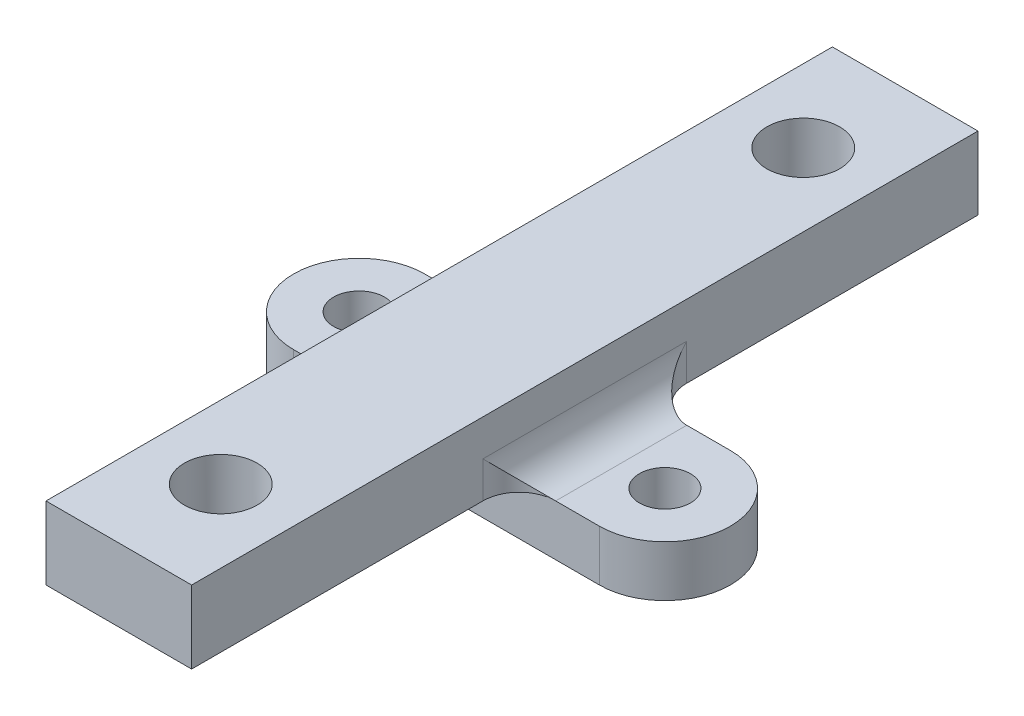
from build123d import *

# Parameters (mm, degrees)
BOSS_EXTRUDE1_DEPTH = 7
SKETCH2_R           = 3
BOSS_EXTRUDE2_DEPTH = 1
SKETCH3_R           = 3.5
CUT_EXTRUDE1_DEPTH  = 5
SKETCH4_R           = 1.5
CUT_EXTRUDE2_DEPTH  = 32.717503054
SKETCH17_W          = 20
SKETCH17_H          = 18
BOSS_EXTRUDE6_DEPTH = 10
SKETCH18_W          = 20
SKETCH18_H          = 10
BOSS_EXTRUDE7_DEPTH = 45
CUT_EXTRUDE6_REACH  = 66.343
SKETCH19_R          = 5
FILLET4_R           = 5
FILLET6_R           = 5
FILLET8_R           = 5


with BuildPart() as part:
    # Sketch1 → Boss-Extrude1 (new body)
    with BuildSketch(Plane(origin=(0, 0, 0), x_dir=(1, 0, 0), z_dir=(0, 1, 0))):
        with BuildLine():
            Line((-21, 9), (21, 9))
            ThreePointArc((21, 9), (30, 0), (21, -9))
            Line((21, -9), (-21, -9))
            ThreePointArc((-21, -9), (-30, 0), (-21, 9))
        make_face()
    extrude(amount=BOSS_EXTRUDE1_DEPTH)

    # Sketch2 → Boss-Extrude2 (add)
    with BuildSketch(Plane.XZ):
        with Locations(Location((-21, 0, 0), (0, 0, 270))):
            Circle(SKETCH2_R)
    boss_extrude2 = extrude(amount=BOSS_EXTRUDE2_DEPTH)

    # Sketch3 → Cut-Extrude1 (cut)
    with BuildSketch(Plane(origin=(0, 7, 0), x_dir=(1, 0, 0), z_dir=(0, 1, 0))):
        with Locations(Location((-21, 0, 0), (0, 0, 270))):
            Circle(SKETCH3_R)
    cut_extrude1 = extrude(amount=-CUT_EXTRUDE1_DEPTH, mode=Mode.SUBTRACT)

    # Sketch4 → Cut-Extrude2 (cut, through all)
    with BuildSketch(Plane(origin=(0, 2, 0), x_dir=(1, 0, 0), z_dir=(0, 1, 0))):
        with Locations(Location((-21, 0, 0), (0, 0, 270))):
            Circle(SKETCH4_R)
    cut_extrude2 = extrude(amount=-CUT_EXTRUDE2_DEPTH, mode=Mode.SUBTRACT)

    # Mirror1: Boss-Extrude2, Cut-Extrude1, Cut-Extrude2 across plane
    add(boss_extrude2.mirror(Plane(origin=(0, 0, 0), x_dir=(0, 0, 1), z_dir=(1, 0, 0))))
    add(cut_extrude1.mirror(Plane(origin=(0, 0, 0), x_dir=(0, 0, 1), z_dir=(1, 0, 0))), mode=Mode.SUBTRACT)
    add(cut_extrude2.mirror(Plane(origin=(0, 0, 0), x_dir=(0, 0, 1), z_dir=(1, 0, 0))), mode=Mode.SUBTRACT)

    # Sketch17 → Boss-Extrude6 (add)
    with BuildSketch(Plane(origin=(0, 7, 0), x_dir=(1, 0, 0), z_dir=(0, 1, 0))):
        Rectangle(SKETCH17_W, SKETCH17_H)
    extrude(amount=BOSS_EXTRUDE6_DEPTH)

    # Sketch18 → Boss-Extrude7 (add)
    with BuildSketch(Plane.XY.offset(9)):
        with Locations((0, 12)):
            Rectangle(SKETCH18_W, SKETCH18_H)
    boss_extrude7 = extrude(amount=BOSS_EXTRUDE7_DEPTH)

    # Mirror3: Boss-Extrude7 across plane
    add(boss_extrude7.mirror(Plane.XY))

    # Sketch19 → Cut-Extrude6 (cut, up to next)
    with BuildSketch(Plane(origin=(0, 17, 0), x_dir=(1, 0, 0), z_dir=(0, 1, 0)), mode=Mode.PRIVATE) as cut_extrude6_sk1:
        with Locations(Location((0, 40, 0), (0, 0, 270))):
            Circle(SKETCH19_R)
    cut_extrude6_tool1 = extrude(cut_extrude6_sk1.sketch, amount=-CUT_EXTRUDE6_REACH, mode=Mode.PRIVATE) & part.part
    cut_extrude6 = cut_extrude6_tool1.solids().sort_by_distance((0, 17, -40))[0]
    add(cut_extrude6, mode=Mode.SUBTRACT)

    # Mirror4: Cut-Extrude6 across plane
    add(cut_extrude6.mirror(Plane.XY), mode=Mode.SUBTRACT)

    # Fillet4
    fillet4_edges = [part.edges().sort_by_distance(p)[0] for p in [
        (10, 7, 0),
    ]]
    fillet(fillet4_edges, radius=FILLET4_R)

    # Fillet6
    fillet6_edges = [part.edges().sort_by_distance(p)[0] for p in [
        (-10, 7, 0),
    ]]
    fillet(fillet6_edges, radius=FILLET6_R)

    # Fillet8
    fillet8_edges = [part.edges().sort_by_distance(p)[0] for p in [
        (-10, 9.5, 9),
        (-10, 9.5, -9),
        (10, 9.5, -9),
        (10, 9.5, 9),
    ]]
    fillet(fillet8_edges, radius=FILLET8_R - 0.0001)  # a hair under: the kernel refuses the full size


solid = part.part
